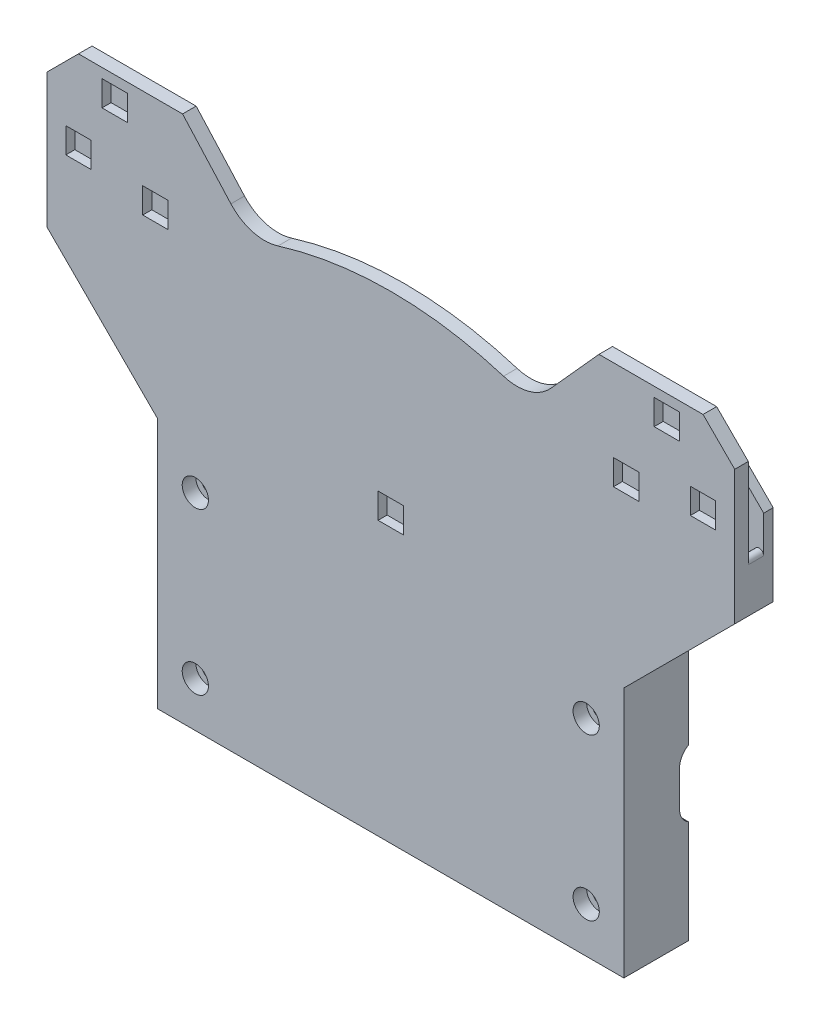
from build123d import *
from build123d.topology import SkipClean

# Parameters (mm, degrees)
SKETCH1_R              = 3.5
SKETCH1_R_2            = 1.5
BOSS_EXTRUDE1_DEPTH    = 5
BOSS_EXTRUDE1_2_DEPTH  = 5
BOSS_EXTRUDE1_3_DEPTH  = 5
BOSS_EXTRUDE1_4_DEPTH  = 5
SKETCH2_W              = 103
SKETCH2_H              = 55.5
SKETCH2_R              = 1.5
BOSS_EXTRUDE2_DEPTH    = 2
SKETCH4_R              = 1.5
BOSS_EXTRUDE3_DEPTH    = 2
SKETCH6_W              = 103
SKETCH6_H              = 55.5
SKETCH6_W_2            = 98
SKETCH6_H_2            = 50.5
BOSS_EXTRUDE4_DEPTH    = 6.6
CUT_EXTRUDE1_DEPTH     = 10
SKETCH9_R              = 1.5
BOSS_EXTRUDE5_DEPTH    = 3
SKETCH10_R             = 1.5
BOSS_EXTRUDE6_DEPTH    = 2.5
BOSS_EXTRUDE7_START    = 1
SKETCH11_R             = 1.5
BOSS_EXTRUDE7_DEPTH    = 1
SKETCH13_W             = 2.5
SKETCH13_H             = 55.5
BOSS_EXTRUDE8_DEPTH    = 11.5
SKETCH14_W             = 2.5
SKETCH14_H             = 55.5
BOSS_EXTRUDE9_DEPTH    = 4.7
SKETCH15_W             = 98
SKETCH15_H             = 2.5
BOSS_EXTRUDE10_DEPTH   = 4.7
BOSS_EXTRUDE11_DEPTH   = 2.5
SKETCH17_R             = 2.9
CUT_EXTRUDE2_DEPTH     = 3
BOSS_EXTRUDE12_DEPTH   = 2.5
CHAMFER1_SIZE          = 7
SKETCH19_W             = 5.6
SKETCH19_H             = 5.6
CUT_EXTRUDE3_DEPTH     = 2
SKETCH20_R             = 1.5
BOSS_EXTRUDE13_DEPTH   = 0.2
CUT_EXTRUDE4_DEPTH     = 3.4
CUT_EXTRUDE5_DEPTH     = 3.1
CHAMFER2_SIZE          = 2
CHAMFER3_SIZE          = 1.5
CUT_EXTRUDE6_DEPTH     = 1.5
FILLET2_R              = 1
FILLET3_R              = 1
CHAMFER4_SIZE          = 1.5
CHAMFER4_SIZE_2        = 2.093850893
BOSS_EXTRUDE14_DEPTH   = 3
FILLET4_R              = 10
SKETCH26_W             = 7
SKETCH26_H             = 10
BOSS_EXTRUDE15_DEPTH   = 5
BOSS_EXTRUDE15_2_DEPTH = 5
SKETCH27_W             = 2
SKETCH27_H             = 10
BOSS_EXTRUDE16_DEPTH   = 15
SKETCH30_R             = 13.3
CUT_EXTRUDE7_DEPTH     = 1


with BuildPart() as part:
    # Sketch1 → Boss-Extrude1 (new body)
    with BuildSketch(Plane.XY):
        with Locations((43.18, -17.78)):
            Circle(SKETCH1_R)
        with Locations((43.18, -17.78)):
            Circle(SKETCH1_R_2, mode=Mode.SUBTRACT)
    extrude(amount=BOSS_EXTRUDE1_DEPTH)



with BuildPart() as body_2:
    # Sketch1 → Boss-Extrude1 2 (new body)
    with BuildSketch(Plane.XY):
        with Locations((43.18, 17.78)):
            Circle(SKETCH1_R)
        with Locations((43.18, 17.78)):
            Circle(SKETCH1_R_2, mode=Mode.SUBTRACT)
    extrude(amount=BOSS_EXTRUDE1_2_DEPTH)


with BuildPart() as body_3:
    # Sketch1 → Boss-Extrude1 3 (new body)
    with BuildSketch(Plane.XY):
        with Locations((-43.18, -17.78)):
            Circle(SKETCH1_R)
        with Locations((-43.18, -17.78)):
            Circle(SKETCH1_R_2, mode=Mode.SUBTRACT)
    extrude(amount=BOSS_EXTRUDE1_3_DEPTH)


with BuildPart() as body_4:
    # Sketch1 → Boss-Extrude1 4 (new body)
    with BuildSketch(Plane.XY):
        with Locations((-43.18, 17.78)):
            Circle(SKETCH1_R)
        with Locations((-43.18, 17.78)):
            Circle(SKETCH1_R_2, mode=Mode.SUBTRACT)
    extrude(amount=BOSS_EXTRUDE1_4_DEPTH)


with BuildPart() as part_1:
    add(part.part)

    add(body_2.part)  # Boss-Extrude2 merges body 2

    add(body_3.part)  # Boss-Extrude2 merges body 3

    add(body_4.part)  # Boss-Extrude2 merges body 4
    # Sketch2 → Boss-Extrude2 (add)
    with BuildSketch(Plane.XY.offset(5)):
        Rectangle(SKETCH2_W, SKETCH2_H)
        with Locations((43.18, -17.78)):
            Circle(SKETCH2_R, mode=Mode.SUBTRACT)
        with Locations((-43.18, -17.78)):
            Circle(SKETCH2_R, mode=Mode.SUBTRACT)
        with Locations((43.18, 17.78)):
            Circle(SKETCH2_R, mode=Mode.SUBTRACT)
        with Locations((-43.18, 17.78)):
            Circle(SKETCH2_R, mode=Mode.SUBTRACT)
    extrude(amount=BOSS_EXTRUDE2_DEPTH)

    # Sketch4 → Boss-Extrude3 (add)
    with BuildSketch(Plane.XY.offset(7)):
        with BuildLine():
            Line((76, -27.75), (76, 88.839975981))
            Line((76, 88.839975981), (46, 88.839975981))
            Line((46, 88.839975981), (28, 68.839975981))
            ThreePointArc((28, 68.839975981), (0, 73.9), (-28, 68.839975981))
            Line((-28, 68.839975981), (-46, 88.839975981))
            Line((-46, 88.839975981), (-76, 88.839975981))
            Line((-76, 88.839975981), (-76, -27.75))
            Line((-76, -27.75), (-51.5, -27.75))
            Line((-51.5, -27.75), (-51.5, 27.75))
            Line((-51.5, 27.75), (51.5, 27.75))
            Line((51.5, 27.75), (51.5, -27.75))
            Line((51.5, -27.75), (76, -27.75))
        make_face()
        with Locations((0, 35.482021314)):
            Circle(SKETCH4_R, mode=Mode.SUBTRACT)
        with Locations((52, 67.9)):
            Circle(SKETCH4_R, mode=Mode.SUBTRACT)
        with Locations((69, 70.9)):
            Circle(SKETCH4_R, mode=Mode.SUBTRACT)
        with Locations((61, 83.9)):
            Circle(SKETCH4_R, mode=Mode.SUBTRACT)
        with Locations((-61, 83.9)):
            Circle(SKETCH4_R, mode=Mode.SUBTRACT)
        with Locations((-69, 70.9)):
            Circle(SKETCH4_R, mode=Mode.SUBTRACT)
        with Locations((-52, 67.9)):
            Circle(SKETCH4_R, mode=Mode.SUBTRACT)
    extrude(amount=-BOSS_EXTRUDE3_DEPTH)

    # Sketch6 → Boss-Extrude4 (add)
    with BuildSketch(Plane(origin=(0, 0, 5), x_dir=(-1, 0, 0), z_dir=(0, 0, -1))):
        Rectangle(SKETCH6_W, SKETCH6_H)
        Rectangle(SKETCH6_W_2, SKETCH6_H_2, mode=Mode.SUBTRACT)
    extrude(amount=BOSS_EXTRUDE4_DEPTH)

    # Sketch7 → Cut-Extrude1 (cut)
    with BuildSketch(Plane(origin=(0, 0, 5), x_dir=(-1, 0, 0), z_dir=(0, 0, -1))):
        Polygon((-51.5, 27.75), (-76, 52.25), (-76, -27.75), (-51.5, -27.75), align=None)
        Polygon((51.5, 27.75), (76, 52.25), (76, -27.75), (51.5, -27.75), align=None)
    extrude(amount=-CUT_EXTRUDE1_DEPTH, mode=Mode.SUBTRACT)

    # Sketch9 → Boss-Extrude5 (add)
    with BuildSketch(Plane(origin=(0, 0, 5), x_dir=(-1, 0, 0), z_dir=(0, 0, -1))):
        with BuildLine():
            Line((76, 52.25), (76, 66.439350686))
            ThreePointArc((76, 66.439350686), (72.408812655, 60.843823784), (66.147142857, 58.608194296))
            ThreePointArc((66.147142857, 58.608194296), (53.382208681, 59.444874773), (40.912117931, 62.2980161))
            ThreePointArc((40.912117931, 62.2980161), (0, 73.6), (-40.912117931, 62.2980161))
            ThreePointArc((-40.912117931, 62.2980161), (-53.382208681, 59.444874773), (-66.147142857, 58.608194296))
            ThreePointArc((-66.147142857, 58.608194296), (-72.408812655, 60.843823784), (-76, 66.439350686))
            Line((-76, 66.439350686), (-76, 52.25))
            Line((-76, 52.25), (-51.5, 27.75))
            Line((-51.5, 27.75), (51.5, 27.75))
            Line((51.5, 27.75), (76, 52.25))
        make_face()
        with Locations(Location((0, 35.482021314, 0), (0, 0, 180))):
            Circle(SKETCH9_R, mode=Mode.SUBTRACT)
    extrude(amount=BOSS_EXTRUDE5_DEPTH)

    # Sketch10 → Boss-Extrude6 (add)
    with BuildSketch(Plane(origin=(0, 0, 2), x_dir=(-1, 0, 0), z_dir=(0, 0, -1))):
        with BuildLine():
            Line((-4.2, 38.495226664), (-5.10612763, 39.55778097))
            ThreePointArc((-5.10612763, 39.55778097), (-32.999338229, 51.509304028), (-49.07063786, 77.25))
            Line((-49.07063786, 77.25), (-76, 77.25))
            Line((-76, 77.25), (-76, 66.439350686))
            Line((-76, 66.439350686), (-76, 52.25))
            Line((-76, 52.25), (-51.5, 27.75))
            Line((-51.5, 27.75), (51.5, 27.75))
            Line((51.5, 27.75), (76, 52.25))
            Line((76, 52.25), (76, 66.439350686))
            Line((76, 66.439350686), (76, 77.25))
            Line((76, 77.25), (49.07063786, 77.25))
            ThreePointArc((49.07063786, 77.25), (33.031550268, 51.53694387), (5.190578777, 39.56640116))
            Line((5.190578777, 39.56640116), (4.2, 38.575822383))
            Line((4.2, 38.575822383), (4.2, 35.482021314))
            ThreePointArc((4.2, 35.482021314), (0, 31.282021314), (-4.2, 35.482021314))
            Line((-4.2, 35.482021314), (-4.2, 38.495226664))
        make_face()
        with Locations(Location((-69, 70.9, 0), (0, 0, 180))):
            Circle(SKETCH10_R, mode=Mode.SUBTRACT)
        with Locations(Location((-52, 67.9, 0), (0, 0, 180))):
            Circle(SKETCH10_R, mode=Mode.SUBTRACT)
        with Locations(Location((52, 67.9, 0), (0, 0, 180))):
            Circle(SKETCH10_R, mode=Mode.SUBTRACT)
        with Locations(Location((69, 70.9, 0), (0, 0, 180))):
            Circle(SKETCH10_R, mode=Mode.SUBTRACT)
    extrude(amount=BOSS_EXTRUDE6_DEPTH)

    # Sketch11 → Boss-Extrude7 (add)
    with BuildSketch(Plane.XY.offset(7).offset(BOSS_EXTRUDE7_START)):
        with BuildLine():
            Line((51.5, -27.75), (51.5, 27.75))
            Line((51.5, 27.75), (76, 52.25))
            Line((76, 52.25), (76, 88.839975981))
            Line((76, 88.839975981), (46, 88.839975981))
            Line((46, 88.839975981), (28, 68.839975981))
            ThreePointArc((28, 68.839975981), (0, 73.9), (-28, 68.839975981))
            Line((-28, 68.839975981), (-46, 88.839975981))
            Line((-46, 88.839975981), (-76, 88.839975981))
            Line((-76, 88.839975981), (-76, 52.25))
            Line((-76, 52.25), (-51.5, 27.75))
            Line((-51.5, 27.75), (-51.5, -27.75))
            Line((-51.5, -27.75), (51.5, -27.75))
        make_face()
        with Locations((43.18, -17.78)):
            Circle(SKETCH11_R, mode=Mode.SUBTRACT)
        with Locations((-43.18, -17.78)):
            Circle(SKETCH11_R, mode=Mode.SUBTRACT)
        with Locations((-43.18, 17.78)):
            Circle(SKETCH11_R, mode=Mode.SUBTRACT)
        with Locations((0, 35.482021314)):
            Circle(SKETCH11_R, mode=Mode.SUBTRACT)
        with Locations((43.18, 17.78)):
            Circle(SKETCH11_R, mode=Mode.SUBTRACT)
        with Locations((61, 83.9)):
            Circle(SKETCH11_R, mode=Mode.SUBTRACT)
        with Locations((69, 70.9)):
            Circle(SKETCH11_R, mode=Mode.SUBTRACT)
        with Locations((52, 67.9)):
            Circle(SKETCH11_R, mode=Mode.SUBTRACT)
        with Locations((-61, 83.9)):
            Circle(SKETCH11_R, mode=Mode.SUBTRACT)
        with Locations((-69, 70.9)):
            Circle(SKETCH11_R, mode=Mode.SUBTRACT)
        with Locations((-52, 67.9)):
            Circle(SKETCH11_R, mode=Mode.SUBTRACT)
    extrude(amount=-BOSS_EXTRUDE7_DEPTH)

    # Sketch13 → Boss-Extrude8 (add)
    with BuildSketch(Plane(origin=(0, 0, -1.6), x_dir=(-1, 0, 0), z_dir=(0, 0, -1))):
        with Locations((50.25, 0)):
            Rectangle(SKETCH13_W, SKETCH13_H)
    extrude(amount=BOSS_EXTRUDE8_DEPTH)

    # Sketch14 → Boss-Extrude9 (add)
    with BuildSketch(Plane(origin=(0, 0, -1.6), x_dir=(-1, 0, 0), z_dir=(0, 0, -1))):
        with Locations((-50.25, 0)):
            Rectangle(SKETCH14_W, SKETCH14_H)
    extrude(amount=BOSS_EXTRUDE9_DEPTH)

    # Sketch15 → Boss-Extrude10 (add)
    with BuildSketch(Plane(origin=(0, 0, -1.6), x_dir=(-1, 0, 0), z_dir=(0, 0, -1))):
        with Locations((0, -26.5)):
            Rectangle(SKETCH15_W, SKETCH15_H)
    extrude(amount=BOSS_EXTRUDE10_DEPTH)

    # Sketch16 → Boss-Extrude11 (add)
    with BuildSketch(Plane(origin=(0, 27.75, 0), x_dir=(1, 0, 0), z_dir=(0, 1, 0))):
        Polygon((-49, 13.1), (-36, 13.1), (-24.5, 1.6), (-49, 1.6), align=None)
        Polygon((49, 6.3), (27.7, 6.3), (23, 1.6), (49, 1.6), align=None)
    extrude(amount=-BOSS_EXTRUDE11_DEPTH)

    # Sketch17 → Cut-Extrude2 (cut)
    with SkipClean():  # the faces are left unmerged after this step: merging them gives an invalid solid
        with BuildSketch(Plane.XY.offset(8)):
            with Locations((-43.18, 17.78)):
                Circle(SKETCH17_R)
            with Locations((-43.18, -17.78)):
                Circle(SKETCH17_R)
            with Locations((43.18, -17.78)):
                Circle(SKETCH17_R)
            with Locations((43.18, 17.78)):
                Circle(SKETCH17_R)
        extrude(amount=-CUT_EXTRUDE2_DEPTH, mode=Mode.SUBTRACT)

    # Sketch18 → Boss-Extrude12 (add)
    with BuildSketch(Plane.XZ.offset(27.75)):
        Polygon((-49, -13.1), (-36, -13.1), (-29.2, -6.3), (-49, -6.3), align=None)
    extrude(amount=-BOSS_EXTRUDE12_DEPTH)

    # Chamfer1
    chamfer1_edges = [part_1.edges().sort_by_distance(p)[0] for p in [
        (76, 77.25, 0.75),
        (-76, 77.25, 0.75),
        (-76, 88.839975981, 6.5),
        (76, 88.839975981, 6.5),
    ]]
    chamfer(chamfer1_edges, length=CHAMFER1_SIZE)

    # Sketch19 → Cut-Extrude3 (cut)
    with BuildSketch(Plane.XY.offset(8)):
        with Locations((0, 35.482021314)):
            Rectangle(SKETCH19_W, SKETCH19_H)
        with Locations((52, 67.9)):
            Rectangle(SKETCH19_W, SKETCH19_H)
        with Locations((69, 70.9)):
            Rectangle(SKETCH19_W, SKETCH19_H)
        with Locations((61, 83.9)):
            Rectangle(SKETCH19_W, SKETCH19_H)
        with Locations((-61, 83.9)):
            Rectangle(SKETCH19_W, SKETCH19_H)
        with Locations((-69, 70.9)):
            Rectangle(SKETCH19_W, SKETCH19_H)
        with Locations((-52, 67.9)):
            Rectangle(SKETCH19_W, SKETCH19_H)
    extrude(amount=-CUT_EXTRUDE3_DEPTH, mode=Mode.SUBTRACT)

    # Sketch20 → Boss-Extrude13 (add)
    with BuildSketch(Plane.XY.offset(6)):
        with Locations((-61, 83.9)):
            Circle(SKETCH20_R)
        with Locations((-69, 70.9)):
            Circle(SKETCH20_R)
        with Locations((-52, 67.9)):
            Circle(SKETCH20_R)
        with Locations((0, 35.482021314)):
            Circle(SKETCH20_R)
        with Locations((52, 67.9)):
            Circle(SKETCH20_R)
        with Locations((69, 70.9)):
            Circle(SKETCH20_R)
        with Locations((61, 83.9)):
            Circle(SKETCH20_R)
    extrude(amount=-BOSS_EXTRUDE13_DEPTH)

    # Sketch21 → Cut-Extrude4 (cut)
    with SkipClean():  # the faces are left unmerged after this step: merging them gives an invalid solid
        with BuildSketch(Plane(origin=(0, 0, 5), x_dir=(-1, 0, 0), z_dir=(0, 0, -1))):
            with BuildLine():
                Line((76, 66.439350686), (76, 81.839975981))
                Line((76, 81.839975981), (69, 88.839975981))
                Line((69, 88.839975981), (46, 88.839975981))
                Line((46, 88.839975981), (28, 68.839975981))
                ThreePointArc((28, 68.839975981), (0, 73.9), (-28, 68.839975981))
                Line((-28, 68.839975981), (-46, 88.839975981))
                Line((-46, 88.839975981), (-69, 88.839975981))
                Line((-69, 88.839975981), (-76, 81.839975981))
                Line((-76, 81.839975981), (-76, 66.439350686))
                ThreePointArc((-76, 66.439350686), (-72.408812655, 60.843823784), (-66.147142857, 58.608194296))
                ThreePointArc((-66.147142857, 58.608194296), (-53.382208681, 59.444874773), (-40.912117931, 62.2980161))
                ThreePointArc((-40.912117931, 62.2980161), (0, 73.6), (40.912117931, 62.2980161))
                ThreePointArc((40.912117931, 62.2980161), (53.382208681, 59.444874773), (66.147142857, 58.608194296))
                ThreePointArc((66.147142857, 58.608194296), (72.408812655, 60.843823784), (76, 66.439350686))
            make_face()
        extrude(amount=CUT_EXTRUDE4_DEPTH, mode=Mode.SUBTRACT)
    add(part_1.part.scale(1), mode=Mode.REPLACE)  # the faces are merged on a copy

    # Sketch22 → Cut-Extrude5 (cut)
    with BuildSketch(Plane(origin=(51.5, 0, 0), x_dir=(0, 0, -1), z_dir=(1, 0, 0))):
        with BuildLine():
            Line((4.3, 6.25), (4.3, -1.55))
            ThreePointArc((4.3, -1.55), (8.3, -5.55), (12.3, -1.55))
            Line((12.3, -1.55), (12.3, 6.25))
            ThreePointArc((12.3, 6.25), (8.3, 10.25), (4.3, 6.25))
        make_face()
    extrude(amount=-CUT_EXTRUDE5_DEPTH, mode=Mode.SUBTRACT)

    # Chamfer2
    chamfer2_edges = [part_1.edges().sort_by_distance(p)[0] for p in [
        (39.68, 17.78, 5),
        (-46.68, -17.78, 5),
        (-46.68, 17.78, 5),
        (39.68, -17.78, 5),
    ]]
    chamfer(chamfer2_edges, length=CHAMFER2_SIZE)

    # Chamfer3
    # the kernel refuses this chamfer: 1.5 mm, written as the material it adds along each edge
    with BuildSketch(Plane(origin=(55.357524482, 27.75, -0.5), x_dir=(0, 0, -1), z_dir=(-1, 0, 0))) as chamfer3_piece_1_section:
        Polygon((CHAMFER3_SIZE, 0), (0, -CHAMFER3_SIZE), (0, 0), align=None)
    chamfer3_piece_1 = extrude(amount=110.715048964, mode=Mode.PRIVATE)
    chamfer3_piece_1 = split(chamfer3_piece_1, bisect_by=Plane(origin=(38.628762241, 27.75, -17.228762241), z_dir=(0.7071067811865439, 0, 0.7071067811865512)), keep=Keep.TOP, mode=Mode.PRIVATE)
    chamfer3_piece_1 = split(chamfer3_piece_1, bisect_by=Plane(origin=(53.428762241, 29.678762241, -0.5), z_dir=(-0.7071067811865438, 0.7071067811865513, 0)), keep=Keep.TOP, mode=Mode.PRIVATE)
    add(chamfer3_piece_1)
    with BuildSketch(Plane(origin=(55.357524482, 27.75, -0.5), x_dir=(0, 0, -1), z_dir=(-1, 0, 0))) as chamfer3_piece_2_section:
        Polygon((CHAMFER3_SIZE, 0), (0, -CHAMFER3_SIZE), (0, 0), align=None)
    chamfer3_piece_2 = extrude(amount=110.715048964, mode=Mode.PRIVATE)
    chamfer3_piece_2 = split(chamfer3_piece_2, bisect_by=Plane(origin=(55.357524482, 27.75, -1.6), z_dir=(0, 0, 1)), keep=Keep.TOP, mode=Mode.PRIVATE)
    chamfer3_piece_2 = split(chamfer3_piece_2, bisect_by=Plane(origin=(53.428762241, 29.678762241, -0.5), z_dir=(-0.7071067811865438, 0.7071067811865513, 0)), keep=Keep.TOP, mode=Mode.PRIVATE)
    chamfer3_piece_2 = split(chamfer3_piece_2, bisect_by=Plane(origin=(1.928762241, -25.678762241, -0.5), z_dir=(0.707106781186547, 0.7071067811865481, 0)), keep=Keep.TOP, mode=Mode.PRIVATE)
    add(chamfer3_piece_2)
    with BuildSketch(Plane(origin=(55.357524482, 27.75, -0.5), x_dir=(0, 0, -1), z_dir=(-1, 0, 0))) as chamfer3_piece_3_section:
        Polygon((CHAMFER3_SIZE, 0), (0, -CHAMFER3_SIZE), (0, 0), align=None)
    chamfer3_piece_3 = extrude(amount=110.715048964, mode=Mode.PRIVATE)
    chamfer3_piece_3 = split(chamfer3_piece_3, bisect_by=Plane(origin=(15.978762241, 27.75, 38.878762241), z_dir=(-0.7071067811865435, 0, 0.7071067811865516)), keep=Keep.TOP, mode=Mode.PRIVATE)
    chamfer3_piece_3 = split(chamfer3_piece_3, bisect_by=Plane(origin=(1.928762241, -25.678762241, -0.5), z_dir=(0.707106781186547, 0.7071067811865481, 0)), keep=Keep.TOP, mode=Mode.PRIVATE)
    add(chamfer3_piece_3)

    # Sketch24 → Cut-Extrude6 (cut)
    with BuildSketch(Plane(origin=(0, 0, -0.5), x_dir=(-1, 0, 0), z_dir=(0, 0, -1))):
        Polygon((16.4411918, 42.251311932), (17.565947072, 37.379461608), (7.279157114, 35.004569018), (6.154401842, 39.876419342), align=None)
    extrude(amount=-CUT_EXTRUDE6_DEPTH, mode=Mode.SUBTRACT)

    # Fillet2
    fillet2_edges = [part_1.edges().sort_by_distance(p)[0] for p in [
        (-6.739398, 37.342522598, -0.5),
        (-17.026187958, 39.717415188, -0.5),
        (-12.422552093, 36.192015313, -0.5),
    ]]
    fillet(fillet2_edges, radius=FILLET2_R)

    # Fillet3
    fillet3_edges = [part_1.edges().sort_by_distance(p)[0] for p in [
        (-76, 66.439350686, 3.3),
        (76, 66.439350686, 3.3),
    ]]
    fillet(fillet3_edges, radius=FILLET3_R)

    # Chamfer4
    # the kernel refuses this chamfer: 2.093850893, 1.5 mm, written as the material it takes off along each edge
    with BuildSketch(Plane(origin=(-49.07063786, 77.25, 7.217843934), x_dir=(0.2721690797102431, -0.9622494437772772, 0), z_dir=(0, 0, -1))) as chamfer4_piece_1_section:
        with BuildLine():
            Line((2.173659878, 0), (-CHAMFER4_SIZE * 0.27216907971, CHAMFER4_SIZE * 0.962249443777))
            Line((-CHAMFER4_SIZE * 0.27216907971, CHAMFER4_SIZE * 0.962249443777), (0, 0))
            ThreePointArc((0, 0), (1.123406089, 0.011637054), (2.173659878, 0))
        make_face()
    chamfer4_piece_1 = extrude(amount=13.335687867, mode=Mode.PRIVATE)
    chamfer4_piece_1 = split(chamfer4_piece_1, bisect_by=Plane(origin=(-49.07063786, 77.25, 5), z_dir=(0, 0, -1)), keep=Keep.TOP, mode=Mode.PRIVATE)
    add(chamfer4_piece_1, mode=Mode.SUBTRACT)
    with BuildSketch(Plane(origin=(49.07063786, 77.25, 7.016198748), x_dir=(1, 0, 0), z_dir=(0, 0, -1))) as chamfer4_piece_2_section:
        with BuildLine():
            Line((CHAMFER4_SIZE_2, 0), (-0.4051132, 1.468182357))
            ThreePointArc((-0.4051132, 1.468182357), (-0.205051029, 0.764600386), (0, 0))
            Line((0, 0), (CHAMFER4_SIZE_2, 0))
        make_face()
    chamfer4_piece_2 = extrude(amount=12.932397496, mode=Mode.PRIVATE)
    chamfer4_piece_2 = split(chamfer4_piece_2, bisect_by=Plane(origin=(49.07063786, 77.25, 5), z_dir=(0, 0, -1)), keep=Keep.TOP, mode=Mode.PRIVATE)
    add(chamfer4_piece_2, mode=Mode.SUBTRACT)

    # Sketch25 → Boss-Extrude14 (add)
    with BuildSketch(Plane.XY.offset(8)):
        with BuildLine():
            Line((-30.865426266, 72.023782943), (-28, 68.839975981))
            ThreePointArc((-28, 68.839975981), (0, 73.9), (28, 68.839975981))
            Line((28, 68.839975981), (30.865426266, 72.023782943))
            ThreePointArc((30.865426266, 72.023782943), (0, 77.9), (-30.865426266, 72.023782943))
        make_face()
    extrude(amount=-BOSS_EXTRUDE14_DEPTH)

    # Fillet4
    fillet4_edges = [part_1.edges().sort_by_distance(p)[0] for p in [
        (30.865426266, 72.023782943, 6.5),
        (-30.865426266, 72.023782943, 6.5),
    ]]
    fillet(fillet4_edges, radius=FILLET4_R)

    # Sketch30 → Cut-Extrude7 (cut)
    with BuildSketch(Plane(origin=(0, 0, -13.1), x_dir=(-1, 0, 0), z_dir=(0, 0, -1))):
        with Locations((43.5, 1.5)):
            Circle(SKETCH30_R)
    extrude(amount=-CUT_EXTRUDE7_DEPTH, mode=Mode.SUBTRACT)


with BuildPart() as body_2_2:
    # Sketch26 → Boss-Extrude15 (new body)
    with BuildSketch(Plane(origin=(0, 0, 5), x_dir=(-1, 0, 0), z_dir=(0, 0, -1))):
        with Locations((-31.5, -16.95)):
            Rectangle(SKETCH26_W, SKETCH26_H)
    extrude(amount=BOSS_EXTRUDE15_DEPTH)



with BuildPart() as body_3_2:
    # Sketch26 → Boss-Extrude15 2 (new body)
    with BuildSketch(Plane(origin=(0, 0, 5), x_dir=(-1, 0, 0), z_dir=(0, 0, -1))):
        with Locations((-9.5, -16.95)):
            Rectangle(SKETCH26_W, SKETCH26_H)
    extrude(amount=BOSS_EXTRUDE15_2_DEPTH)


with BuildPart() as body_2_2_1:
    add(body_2_2.part)

    add(body_3_2.part)  # Boss-Extrude16 merges body 3 2
    # Sketch27 → Boss-Extrude16 (add)
    with BuildSketch(Plane(origin=(13, 0, 0), x_dir=(0, 0, -1), z_dir=(1, 0, 0))):
        with Locations((-4, -16.95)):
            Rectangle(SKETCH27_W, SKETCH27_H)
    extrude(amount=BOSS_EXTRUDE16_DEPTH)


solid = Compound([part_1.part, body_2_2_1.part])
